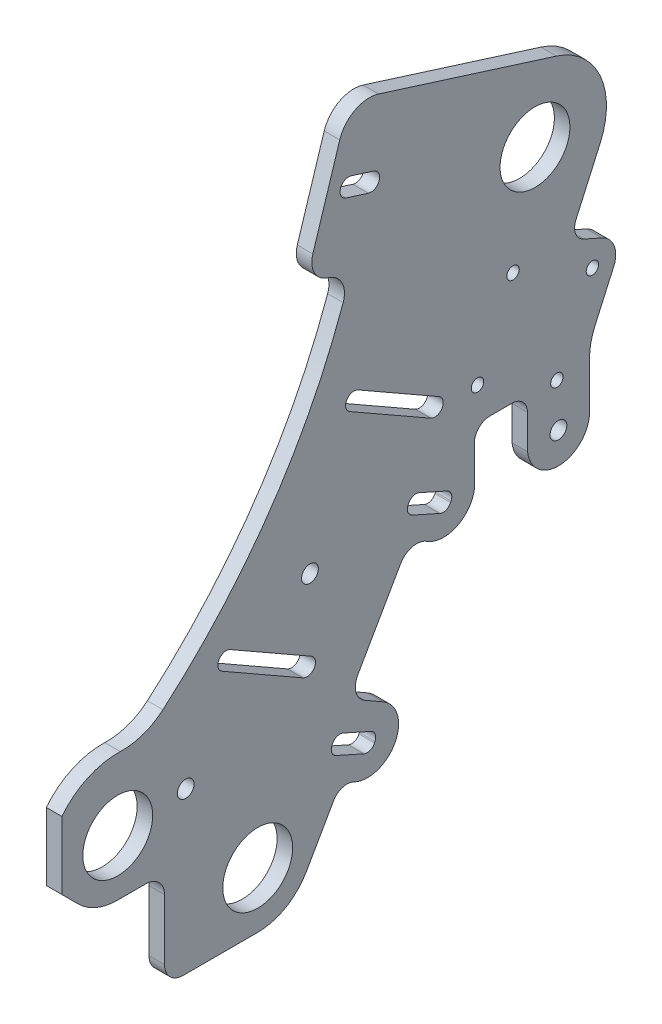
from build123d import *

# Parameters (mm, degrees)
BOSS_EXTRUDE1_DEPTH      = 3.175
BOSS_EXTRUDE1_DEPTH_BACK = 3.175
CUT_EXTRUDE1_DEPTH       = 290.607110863
CUT_EXTRUDE1_DEPTH_BACK  = 290.607110863
SKETCH1_R                = 14.2875
SKETCH1_R_2              = 3.429
SKETCH1_R_3              = 2.54


with BuildPart() as part:
    # Sketch2 → Boss-Extrude1 (new, two sides: drawn at the far end of the back side and taken through both)
    with BuildSketch(Plane(origin=(0, 0, 0), x_dir=(0, 0, -1), z_dir=(1, 0, 0)).offset(-BOSS_EXTRUDE1_DEPTH_BACK)):
        with BuildLine():
            Line((-80.077770294, 30.595392043), (-80.077770294, 58.247946829))
            ThreePointArc((-80.077770294, 58.247946829), (-69.442421386, 66.593204099), (-56.188647306, 69.256179485))
            ThreePointArc((-56.188647306, 69.256179485), (-46.886526626, 70.672129884), (-38.738117997, 75.377212399))
            ThreePointArc((-38.738117997, 75.377212399), (5.090213079, 124.221234623), (34.945098816, 182.662204067))
            ThreePointArc((34.945098816, 182.662204067), (34.521299637, 189.805593755), (29.082706129, 194.456327313))
            Line((29.082706129, 194.456327313), (28.518829965, 194.634116785))
            ThreePointArc((28.518829965, 194.634116785), (23.157656737, 199.132675263), (22.547695998, 206.104558413))
            Line((22.547695998, 206.104558413), (33.54631132, 240.987709604))
            ThreePointArc((33.54631132, 240.987709604), (39.794309207, 248.433783532), (49.477480248, 249.280951225))
            Line((49.477480248, 249.280951225), (122.150711895, 226.367169303))
            ThreePointArc((122.150711895, 226.367169303), (140.010124085, 210.48294899), (140.030981809, 186.581764423))
            Line((140.030981809, 186.581764423), (130.104480463, 164.390792728))
            ThreePointArc((130.104480463, 164.390792728), (129.968779077, 159.532608009), (133.308079065, 156.001397279))
            Line((133.308079065, 156.001397279), (140.746750384, 152.673918795))
            ThreePointArc((140.746750384, 152.673918795), (145.755700367, 147.3771027), (145.552148287, 140.089825622))
            Line((145.552148287, 140.089825622), (137.877491605, 122.932915722))
            ThreePointArc((137.877491605, 122.932915722), (136.223148612, 117.86395827), (135.663479706, 112.561322028))
            Line((135.663479706, 112.561322028), (135.663479706, 93.526234079))
            ThreePointArc((135.663479706, 93.526234079), (123.627643324, 80.843612635), (110.332946369, 92.199724514))
            Line((110.332946369, 92.199724514), (110.287974786, 92.199724514))
            Line((110.287974786, 92.199724514), (110.287974786, 106.169724514))
            ThreePointArc((110.287974786, 106.169724514), (108.428102847, 110.659852575), (103.937974786, 112.519724514))
            Line((103.937974786, 112.519724514), (94.944067794, 112.519724514))
            ThreePointArc((94.944067794, 112.519724514), (90.453939734, 110.659852575), (88.594067794, 106.169724514))
            Line((88.594067794, 106.169724514), (88.594067794, 92.199724514))
            Line((88.594067794, 92.199724514), (88.594067794, 89.813112686))
            ThreePointArc((88.594067794, 89.813112686), (81.258269009, 80.137892516), (69.150347517, 81.044571224))
            ThreePointArc((69.150347517, 81.044571224), (63.214959672, 82.045828247), (58.4047538, 78.427366702))
            Line((58.4047538, 78.427366702), (40.912383352, 47.86429176))
            ThreePointArc((40.912383352, 47.86429176), (40.172936643, 42.0792631), (43.740701856, 37.465762324))
            Line((43.740701856, 37.465762324), (51.225250159, 33.182080404))
            ThreePointArc((51.225250159, 33.182080404), (56.134461156, 16.205485457), (39.322849283, 10.758024134))
            ThreePointArc((39.322849283, 10.758024134), (34.662129764, 11.127507824), (31.011761812, 8.206268627))
            Line((31.011761812, 8.206268627), (19.850909717, -11.336709549))
            ThreePointArc((19.850909717, -11.336709549), (11.476550434, -19.770391755), (0, -22.86))
            Line((0, -22.86), (-30.48, -22.86))
            ThreePointArc((-30.48, -22.86), (-35.868153673, -20.628153673), (-38.1, -15.24))
            Line((-38.1, -15.24), (-38.1, 9.584314079))
            ThreePointArc((-38.1, 9.584314079), (-40.331846327, 14.972467752), (-45.72, 17.204314079))
            Line((-45.72, 17.204314079), (-57.217770294, 17.204314079))
            ThreePointArc((-57.217770294, 17.204314079), (-65.965913557, 18.944427966), (-73.382231312, 23.899853061))
            Line((-73.382231312, 23.899853061), (-80.077770294, 30.595392043))
        make_face()
    extrude(amount=BOSS_EXTRUDE1_DEPTH + BOSS_EXTRUDE1_DEPTH_BACK)

    # Sketch1 → Cut-Extrude1 (cut, two sides: drawn at the far end of the back side and taken through both)
    with BuildSketch(Plane(origin=(0, 0, 0), x_dir=(0, 0, -1), z_dir=(1, 0, 0)).offset(-CUT_EXTRUDE1_DEPTH_BACK)):
        Circle(SKETCH1_R)
        with Locations((-57.217770294, 40.064314079)):
            Circle(SKETCH1_R)
        with Locations((113.367095492, 198.509097171)):
            Circle(SKETCH1_R)
        with Locations((-29.436520294, 42.726234079)):
            Circle(SKETCH1_R_2)
        with Locations((21.363479706, 93.526234079)):
            Circle(SKETCH1_R_2)
        with Locations((122.963479706, 93.526234079)):
            Circle(SKETCH1_R_2)
        with Locations((104.397019406, 158.499404428)):
            Circle(SKETCH1_R_3)
        with Locations((136.857402749, 143.979173257)):
            Circle(SKETCH1_R_3)
        with Locations((122.337171578, 111.518789914)):
            Circle(SKETCH1_R_3)
        with Locations((89.876788235, 126.039021086)):
            Circle(SKETCH1_R_3)
        with BuildLine():
            Line((30.555516965, 28.585224085), (30.360175827, 28.148630754))
            ThreePointArc((30.360175827, 28.148630754), (30.289083082, 25.61101973), (32.033174884, 23.766387604))
            Line((32.033174884, 23.766387604), (43.366777865, 18.695492686))
            ThreePointArc((43.366777865, 18.695492686), (45.904388889, 18.624399941), (47.749021015, 20.368491743))
            Line((47.749021015, 20.368491743), (47.944362153, 20.805085073))
            ThreePointArc((47.944362153, 20.805085073), (48.015454897, 23.342696098), (46.271363096, 25.187328223))
            Line((46.271363096, 25.187328223), (34.937760115, 30.258223141))
            ThreePointArc((34.937760115, 30.258223141), (32.40014909, 30.329315886), (30.555516965, 28.585224085))
        make_face()
        with BuildLine():
            Line((36.134107155, 219.131995286), (45.218261111, 216.267772546))
            ThreePointArc((45.218261111, 216.267772546), (49.67898841, 218.5898802), (47.356880757, 223.0506075))
            Line((47.356880757, 223.0506075), (38.272726801, 225.91483024))
            ThreePointArc((38.272726801, 225.91483024), (33.811999501, 223.592722586), (36.134107155, 219.131995286))
        make_face()
        with BuildLine():
            Line((61.67607301, 98.140604836), (61.480731873, 97.704011505))
            ThreePointArc((61.480731873, 97.704011505), (61.409639128, 95.166400481), (63.153730929, 93.321768355))
            Line((63.153730929, 93.321768355), (74.487333911, 88.250873437))
            ThreePointArc((74.487333911, 88.250873437), (77.024944935, 88.179780692), (78.86957706, 89.923872494))
            Line((78.86957706, 89.923872494), (79.064918198, 90.360465824))
            ThreePointArc((79.064918198, 90.360465824), (79.136010943, 92.898076849), (77.391919142, 94.742708974))
            Line((77.391919142, 94.742708974), (66.05831616, 99.813603892))
            ThreePointArc((66.05831616, 99.813603892), (63.520705136, 99.884696637), (61.67607301, 98.140604836))
        make_face()
        with BuildLine():
            Line((70.728471243, 123.847620068), (37.643621714, 142.742135984))
            ThreePointArc((37.643621714, 142.742135984), (36.366491689, 147.420278874), (41.044634579, 148.697408899))
            Line((41.044634579, 148.697408899), (74.129484108, 129.802892984))
            ThreePointArc((74.129484108, 129.802892984), (75.406614133, 125.124750094), (70.728471243, 123.847620068))
        make_face()
        with BuildLine():
            Line((18.510143371, 58.020820068), (-14.574706157, 76.915335983))
            ThreePointArc((-14.574706157, 76.915335983), (-15.851836182, 81.593478873), (-11.173693292, 82.870608899))
            Line((-11.173693292, 82.870608899), (21.911156236, 63.976092983))
            ThreePointArc((21.911156236, 63.976092983), (23.188286261, 59.297950093), (18.510143371, 58.020820068))
        make_face()
    extrude(amount=CUT_EXTRUDE1_DEPTH + CUT_EXTRUDE1_DEPTH_BACK, mode=Mode.SUBTRACT)


solid = part.part
